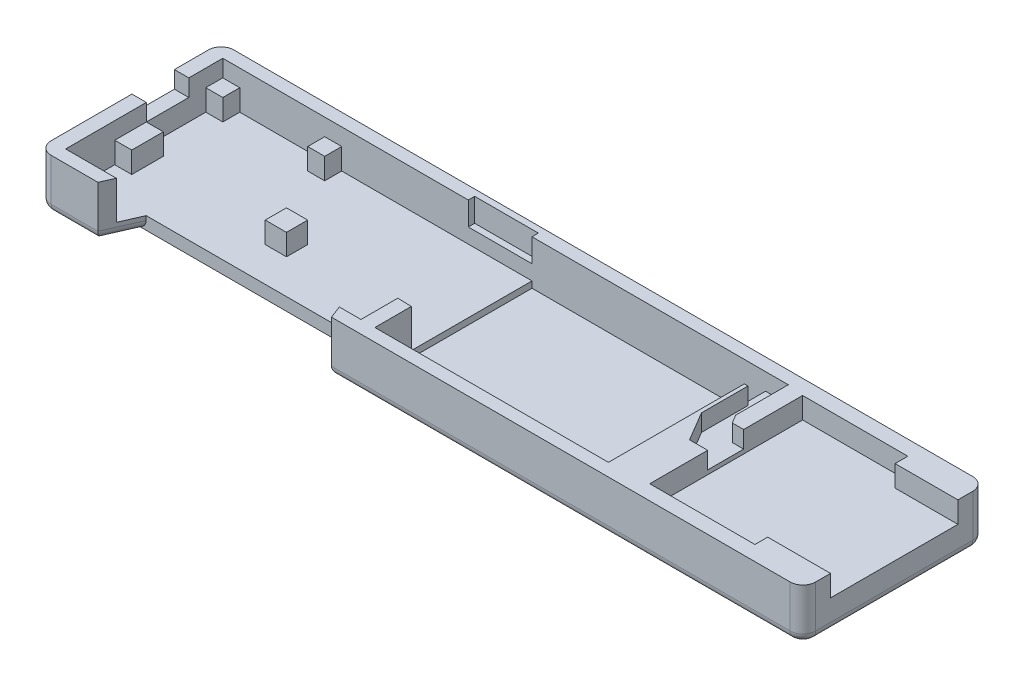
from build123d import *

# Parameters (mm, degrees)
SKETCH_3_W           = 180
SKETCH_3_H           = 43
EXTRUDE_1_DEPTH      = 12
CUT_EXTRUDE_1_DEPTH  = 52
CUT_EXTRUDE_2_DEPTH  = 5
CUT_EXTRUDE_3_DEPTH  = 5
SKETCH_8_W           = 55
SKETCH_8_H           = 37
CUT_EXTRUDE_4_DEPTH  = 10.5
CUT_EXTRUDE_5_DEPTH  = 4
SKETCH_10_W          = 62.128790526
SKETCH_10_H          = 8.683746703
CUT_EXTRUDE_6_DEPTH  = 8
CUT_EXTRUDE_8_DEPTH  = 9
FILLET_2_R           = 2
FILLET_3_R           = 3
SKETCH_12_W          = 10
SKETCH_12_H          = 4
CUT_EXTRUDE_9_DEPTH  = 10
SKETCH_13_W          = 4
SKETCH_13_H          = 4
SKETCH_13_H_2        = 7.435323836
SKETCH_13_W_2        = 5
SKETCH_13_H_3        = 5
EXTRUDE_2_DEPTH      = 5
SKETCH_14_W          = 15
SKETCH_14_H          = 1.5
CUT_EXTRUDE_10_DEPTH = 5.5


with BuildPart() as part:
    # 草图3 → 凸台-拉伸1 (new body)
    with BuildSketch(Plane(origin=(0, 0, 0), x_dir=(1, 0, 0), z_dir=(0, 1, 0))):
        with Locations((50.068597249, 7.753123643)):
            Rectangle(SKETCH_3_W, SKETCH_3_H)
    extrude(amount=EXTRUDE_1_DEPTH)

    # 草图4 → 切除-拉伸1 (cut)
    with BuildSketch(Plane(origin=(0, 0, 0), x_dir=(1, 0, 0), z_dir=(0, 1, 0))):
        Polygon((-22.469613434, -5.858946979), (26.002261286, -5.858946979), (29.068597249, -13.746876357), (-25.931402751, -13.746876357), align=None)
    extrude(amount=CUT_EXTRUDE_1_DEPTH, mode=Mode.SUBTRACT)

    # 草图5 → 切除-拉伸2 (cut)
    with BuildSketch(Plane(origin=(0, 12, 0), x_dir=(1, 0, 0), z_dir=(0, 1, 0))):
        Polygon((140.068597249, 7.753123643), (140.068597249, 22.753123643), (125.276479966, 22.753123643), (125.276479966, -7.246876357), (140.068597249, -7.246876357), align=None)
    extrude(amount=-CUT_EXTRUDE_2_DEPTH, mode=Mode.SUBTRACT)

    # 草图7 → 切除-拉伸3 (cut)
    with BuildSketch(Plane(origin=(0, 12, 0), x_dir=(1, 0, 0), z_dir=(0, 1, 0))):
        Polygon((125.276479966, 7.753123643), (125.276479966, 25.753123643), (100.500825538, 25.753123643), (100.500825538, -10.246876357), (125.276479966, -10.246876357), align=None)
    extrude(amount=-CUT_EXTRUDE_3_DEPTH, mode=Mode.SUBTRACT)

    # 草图8 → 切除-拉伸4 (cut)
    with BuildSketch(Plane(origin=(0, 12, 0), x_dir=(1, 0, 0), z_dir=(0, 1, 0))):
        with Locations((63.776287419, 7.753123643)):
            Rectangle(SKETCH_8_W, SKETCH_8_H)
    extrude(amount=-CUT_EXTRUDE_4_DEPTH, mode=Mode.SUBTRACT)

    # 草图9 → 切除-拉伸5 (cut)
    with BuildSketch(Plane(origin=(0, 12, 0), x_dir=(1, 0, 0), z_dir=(0, 1, 0))):
        Polygon((91.276287419, 26.253123643), (96.635770173, 26.253123643), (96.635770173, 22.130591531), (96.635770173, 13.862098754), (97.813575381, 11.877191358), (100.500825538, 11.877191358), (100.500825538, 3.393971617), (96.236747254, 3.393971617), (92.132656028, 10.310430274), (92.132656028, 21.255120764), (91.276287419, 21.255120764), align=None)
    extrude(amount=-CUT_EXTRUDE_5_DEPTH, mode=Mode.SUBTRACT)

    # 草图10 → 切除-拉伸6 (cut)
    with BuildSketch(Plane(origin=(0, 12, 0), x_dir=(1, 0, 0), z_dir=(0, 1, 0))):
        with Locations((1.934159822, -6.405003006)):
            Rectangle(SKETCH_10_W, SKETCH_10_H)
    extrude(amount=-CUT_EXTRUDE_6_DEPTH, mode=Mode.SUBTRACT)

    # 草图11 → 切除-拉伸8 (cut)
    with BuildSketch(Plane(origin=(0, 12, 0), x_dir=(1, 0, 0), z_dir=(0, 1, 0))):
        Polygon((32.998555085, -10.746876357), (-36.5396752, -10.746876357), (-36.5396752, 26.253123643), (36.276287419, 26.253123643), (36.276287419, -2.167243749), (32.998555085, -2.063129654), align=None)
    extrude(amount=-CUT_EXTRUDE_8_DEPTH, mode=Mode.SUBTRACT)

    # 圆角2
    fillet_2_edges = [part.edges().sort_by_distance(p)[0] for p in [
        (84.568597249, 0, 13.746876357),
        (-24.200508092, 0, 9.802911668),
        (27.535429268, 0, 9.802911668),
        (50.068597249, 0, -29.253123643),
        (140.068597249, 0, -7.753123643),
        (-32.931402751, 0, 13.746876357),
        (-39.931402751, 0, -7.753123643),
    ]]
    fillet(fillet_2_edges, radius=FILLET_2_R)

    # 圆角3
    # the kernel refuses this fillet: 3 mm, written as the material it takes off along each edge
    with BuildSketch(Plane(origin=(-36.931402751, 0, 10.746876357), x_dir=(0, 0, 1), z_dir=(1, 0, 0))) as fillet_3_piece_1:
        with BuildLine():
            CenterArc((1, -2), 2, 0, 90)
            Line((3, -2), (3, 0))
            Line((3, 0), (1, 0))
        make_face()
    revolve(axis=Axis((-36.931402751, 0, 10.746876357), (0, -1, 0)), revolution_arc=90, mode=Mode.SUBTRACT)
    with BuildSketch(Plane(origin=(-36.931402751, 0, -26.253123643), x_dir=(-1, 0, 0), z_dir=(0, 0, 1))) as fillet_3_piece_2:
        with BuildLine():
            CenterArc((1, -2), 2, 0, 90)
            Line((3, -2), (3, 0))
            Line((3, 0), (1, 0))
        make_face()
    revolve(axis=Axis((-36.931402751, 0, -26.253123643), (0, -1, 0)), revolution_arc=90, mode=Mode.SUBTRACT)
    with BuildSketch(Plane(origin=(137.068597249, 0, 10.746876357), x_dir=(1, 0, 0), z_dir=(0, 0, -1))) as fillet_3_piece_3:
        with BuildLine():
            CenterArc((1, -2), 2, 0, 90)
            Line((3, -2), (3, 0))
            Line((3, 0), (1, 0))
        make_face()
    revolve(axis=Axis((137.068597249, 0, 10.746876357), (0, -1, 0)), revolution_arc=90, mode=Mode.SUBTRACT)
    with BuildSketch(Plane(origin=(137.068597249, 0, -26.253123643), x_dir=(0, 0, -1), z_dir=(-1, 0, 0))) as fillet_3_piece_4:
        with BuildLine():
            CenterArc((1, -2), 2, 0, 90)
            Line((3, -2), (3, 0))
            Line((3, 0), (1, 0))
        make_face()
    revolve(axis=Axis((137.068597249, 0, -26.253123643), (0, -1, 0)), revolution_arc=90, mode=Mode.SUBTRACT)
    with BuildSketch(Plane(origin=(-39.931402751, 0, -29.253123643), x_dir=(1, 0, 0), z_dir=(0, 1, 0))) as fillet_3_piece_5:
        with BuildLine():
            CenterArc((FILLET_3_R, -FILLET_3_R), FILLET_3_R, 90, 90)
            Line((0, -FILLET_3_R), (0, 0))
            Line((0, 0), (FILLET_3_R, 0))
        make_face()
    extrude(amount=19.5, mode=Mode.SUBTRACT)
    with BuildSketch(Plane(origin=(140.068597249, 0, -29.253123643), x_dir=(-1, 0, 0), z_dir=(0, 1, 0)), Plane(origin=(140.068597249, 0, 13.746876357), x_dir=(0, 0, -1), z_dir=(0, 1, 0)), Plane(origin=(-39.931402751, 0, 13.746876357), x_dir=(1, 0, 0), z_dir=(0, 1, 0))) as fillet_3_piece_6:
        with BuildLine():
            CenterArc((FILLET_3_R, FILLET_3_R), FILLET_3_R, 180, 90)
            Line((0, FILLET_3_R), (0, 0))
            Line((0, 0), (FILLET_3_R, 0))
        make_face()
    extrude(amount=19.5, mode=Mode.SUBTRACT)

    # 草图12 → 切除-拉伸9 (cut)
    with BuildSketch(Plane(origin=(-36.5396752, 0, 0), x_dir=(0, 0, -1), z_dir=(1, 0, 0))):
        with Locations((13.253123643, 10)):
            Rectangle(SKETCH_12_W, SKETCH_12_H)
    extrude(amount=-CUT_EXTRUDE_9_DEPTH, mode=Mode.SUBTRACT)

    # 草图13 → 凸台-拉伸2 (add)
    with BuildSketch(Plane(origin=(0, 3, 0), x_dir=(1, 0, 0), z_dir=(0, 1, 0))):
        with Locations((-34.5396752, 24.253123643)):
            Rectangle(SKETCH_13_W, SKETCH_13_H)
        with Locations((-34.5396752, 4.535461725)):
            Rectangle(SKETCH_13_W, SKETCH_13_H_2)
        with Locations((-10.5396752, 24.253123643)):
            Rectangle(SKETCH_13_W, SKETCH_13_H)
        with Locations((-0.0396752, 4.753123643)):
            Rectangle(SKETCH_13_W_2, SKETCH_13_H_3)
    extrude(amount=EXTRUDE_2_DEPTH)

    # 草图14 → 切除-拉伸10 (cut)
    with BuildSketch(Plane(origin=(0, 12, 0), x_dir=(1, 0, 0), z_dir=(0, 1, 0))):
        with Locations((28.776287419, 27.003123643)):
            Rectangle(SKETCH_14_W, SKETCH_14_H)
    extrude(amount=-CUT_EXTRUDE_10_DEPTH, mode=Mode.SUBTRACT)


solid = part.part
